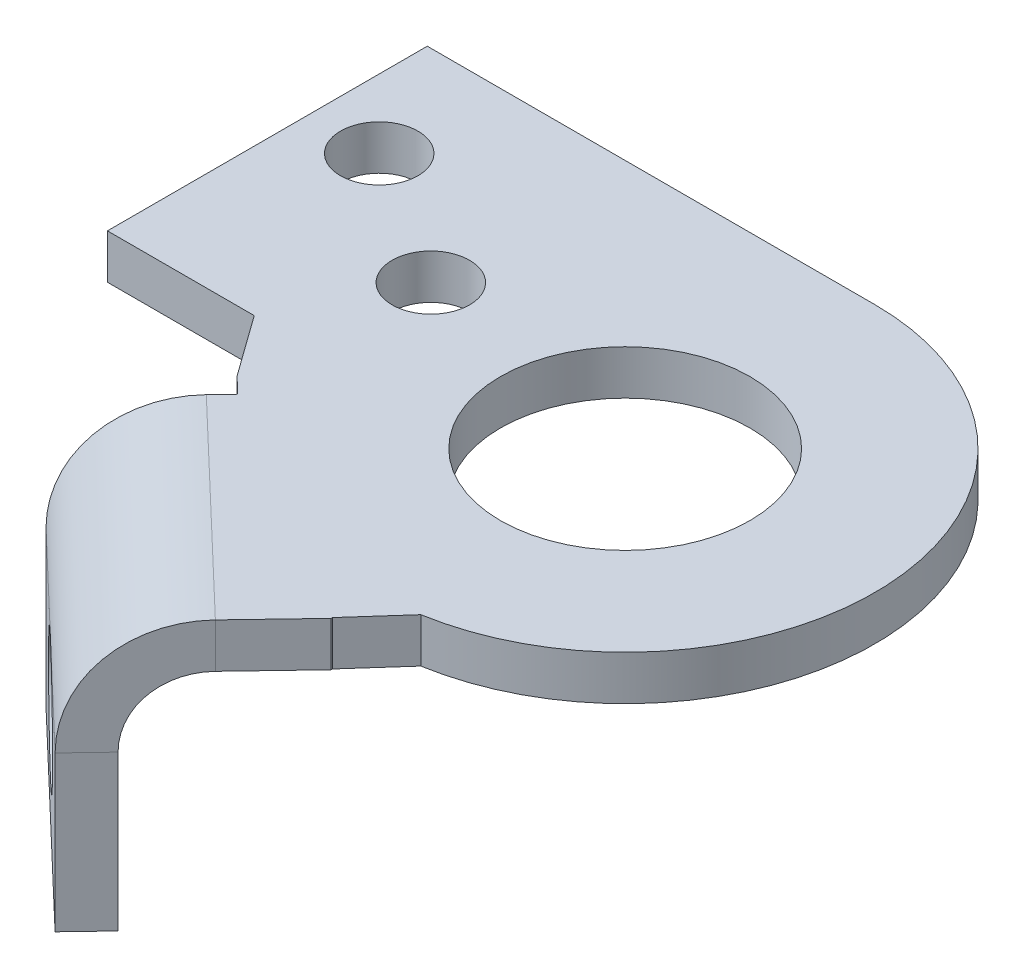
from build123d import *

# Parameters (mm, degrees)
BOSS_EXTRUDE1_DEPTH           = 3.175
CONVERT_SOLID1_START          = 2.588
CONVERT_SOLID1_DEPTH          = 0.587
EDGE_FLANGE1_STRIP_W          = 18.352
EDGE_FLANGE1_STRIP_H          = 2.588
EDGE_FLANGE1_STRIP_CUT_DEPTH  = 16.036353891
EDGE_FLANGE1_RELIEF_W         = 19.646
EDGE_FLANGE1_RELIEF_H         = 1.294
EDGE_FLANGE1_RELIEF_CUT_DEPTH = 2.588
EDGE_FLANGE1_DEPTH            = 16.036353891
SKETCH9_R                     = 3.5
CUT_EXTRUDE1_DEPTH            = 47.081558227
CUT_EXTRUDE2_DEPTH            = 41.148221328
M4_CLEARANCE_HOLE1_D          = 4.5
BOSS_EXTRUDE2_DEPTH           = 2.588
SKETCH19_R                    = 7.25
CUT_EXTRUDE3_DEPTH            = 41.148221328
SKETCH20_W                    = 2
SKETCH20_H                    = 21.253234492
CUT_EXTRUDE4_DEPTH            = 10


# Read off the part's stored shape, not the designer's step: Convert-Solid1
# Sheet-metal steps are written as plain solids
with BuildPart() as part:
    # Sketch1 → Boss-Extrude1 (new body)
    with BuildSketch(Plane(origin=(0, 0, 0), x_dir=(1, 0, 0), z_dir=(0, 1, 0))):
        with BuildLine():
            Line((0, 14.5), (-27, 14.5))
            Line((-27, 14.5), (-27, -4.086))
            Line((-27, -4.086), (-19.43303559, -4.086))
            Line((-19.43303559, -4.086), (-19.43303559, -14.223687844))
            Line((-19.43303559, -14.223687844), (-7.832786234, -25.296124838))
            Line((-7.832786234, -25.296124838), (0, -25.296124838))
            Line((0, -25.296124838), (0, -14.5))
            ThreePointArc((0, -14.5), (14.5, 0), (0, 14.5))
        make_face()
    extrude(amount=BOSS_EXTRUDE1_DEPTH)

    # Convert-Solid1 outline → Convert-Solid1 (cut)
    with BuildSketch(Plane(origin=(0, 0, 0), x_dir=(1, 0, 0), z_dir=(0, 1, 0)).offset(CONVERT_SOLID1_START)):
        with BuildLine():
            Line((0, 14.5), (-27, 14.5))
            Line((-27, 14.5), (-27, -4.086))
            Line((-27, -4.086), (-19.43303559, -4.086))
            Line((-19.43303559, -4.086), (-19.43303559, -14.223687844))
            Line((-19.43303559, -14.223687844), (-7.832786234, -25.296124838))
            Line((-7.832786234, -25.296124838), (0, -25.296124838))
            Line((0, -25.296124838), (0, -14.5))
            ThreePointArc((0, -14.5), (14.5, 0), (0, 14.5))
        make_face()
    extrude(amount=CONVERT_SOLID1_DEPTH, mode=Mode.SUBTRACT)

    # Edge-Flange1 strip (across the edge) → Edge-Flange1 strip cut (cut)
    with BuildSketch(Plane(origin=(-7.832786234, 0, 25.296124838), x_dir=(0.6904585088002791, -3.4914813388431334e-15, -0.7233719980931629), z_dir=(-0.7233719980931629, 0, -0.6904585088002791))):
        with Locations((-2.588, -1.294)):
            Rectangle(EDGE_FLANGE1_STRIP_W, EDGE_FLANGE1_STRIP_H)
    extrude(amount=EDGE_FLANGE1_STRIP_CUT_DEPTH, mode=Mode.SUBTRACT)

    # Edge-Flange1 relief (on the sheet) → Edge-Flange1 relief cut (cut)
    with BuildSketch(Plane(origin=(-3.284045578, 0, 20.530550115), x_dir=(0.6904585088002791, -6.982962677686267e-15, -0.7233719980931629), z_dir=(0, -1, 0))):
        with Locations((-8.529, 0.647)):
            Rectangle(EDGE_FLANGE1_RELIEF_W, EDGE_FLANGE1_RELIEF_H)
        with Locations((-8.529, -16.683353891)):
            Rectangle(EDGE_FLANGE1_RELIEF_W, EDGE_FLANGE1_RELIEF_H)
    extrude(amount=-EDGE_FLANGE1_RELIEF_CUT_DEPTH, mode=Mode.SUBTRACT)

    # Edge-Flange1 section (across the edge) → Edge-Flange1 (add)
    with BuildSketch(Plane(origin=(-7.832786234, 0, 25.296124838), x_dir=(0.6904585088002791, -3.4914813388431334e-15, -0.7233719980931629), z_dir=(-0.7233719980931629, 0, -0.6904585088002791))):
        with BuildLine():
            Line((0, 4), (0, 13))
            Line((0, 13), (2.588, 13))
            Line((2.588, 13), (2.588, 4))
            ThreePointArc((2.588, 4), (3.759572875, 1.171572875), (6.588, 0))
            Line((6.588, 0), (6.588, -2.588))
            ThreePointArc((6.588, -2.588), (1.929580526, -0.658419474), (0, 4))
        make_face()
    extrude(amount=EDGE_FLANGE1_DEPTH)

    # Sketch9 → Cut-Extrude1 (cut, through all)
    with BuildSketch(Plane(origin=(-16.368508108, 0, 17.148779057), x_dir=(0.7233719980931632, 3.1973878914611357e-15, 0.6904585088002789), z_dir=(-0.6904585088002789, 3.4046985453530564e-15, 0.7233719980931632))):
        with Locations(Location((3.78172946, -7.5, 0), (0, 0, 90))):
            Circle(SKETCH9_R)
    extrude(amount=-CUT_EXTRUDE1_DEPTH, mode=Mode.SUBTRACT)

    # Sketch10 → Cut-Extrude2 (cut, through all)
    with BuildSketch(Plane(origin=(0, 2.588, 0), x_dir=(1, 0, 0), z_dir=(0, 1, 0))):
        Polygon((-19.43303559, -4.086), (-17.470094505, -4.086), (-14.926884989, -7.628616445), (-19.43303559, -12.349570886), align=None)
        Polygon((0, -25.296124838), (-7.832786234, -25.296124838), (0, -17.08995726), align=None)
    extrude(amount=-CUT_EXTRUDE2_DEPTH, mode=Mode.SUBTRACT)

    # M4 Clearance Hole1 (through all)
    with Locations(Plane(origin=(0, 2.588, 0), x_dir=(1, 0, 0), z_dir=(0, 1, 0))):
        with Locations((-22, 7.707), (-14, 2.707)):
            Hole(M4_CLEARANCE_HOLE1_D / 2)

    # Sketch17 → Boss-Extrude2 (add)
    with BuildSketch(Plane(origin=(0, 2.588, 0), x_dir=(1, 0, 0), z_dir=(0, 1, 0))):
        Polygon((-1.098945785, -18.241288728), (4.611253989, -11.842333594), (-0.672962036, -12.348247452), align=None)
    extrude(amount=-BOSS_EXTRUDE2_DEPTH)

    # Sketch19 → Cut-Extrude3 (cut, through all)
    with BuildSketch(Plane(origin=(0, 2.588, 0), x_dir=(1, 0, 0), z_dir=(0, 1, 0))):
        with Locations(Location((0, 0, 0), (0, 0, 270))):
            Circle(SKETCH19_R)
    extrude(amount=-CUT_EXTRUDE3_DEPTH, mode=Mode.SUBTRACT)

    # Sketch20 → Cut-Extrude4 (cut)
    with BuildSketch(Plane(origin=(0, 2.588, 0), x_dir=(1, 0, 0), z_dir=(0, 1, 0))):
        with Locations((-27, 5.207)):
            Rectangle(SKETCH20_W, SKETCH20_H)
    extrude(amount=-CUT_EXTRUDE4_DEPTH, mode=Mode.SUBTRACT)


solid = part.part
